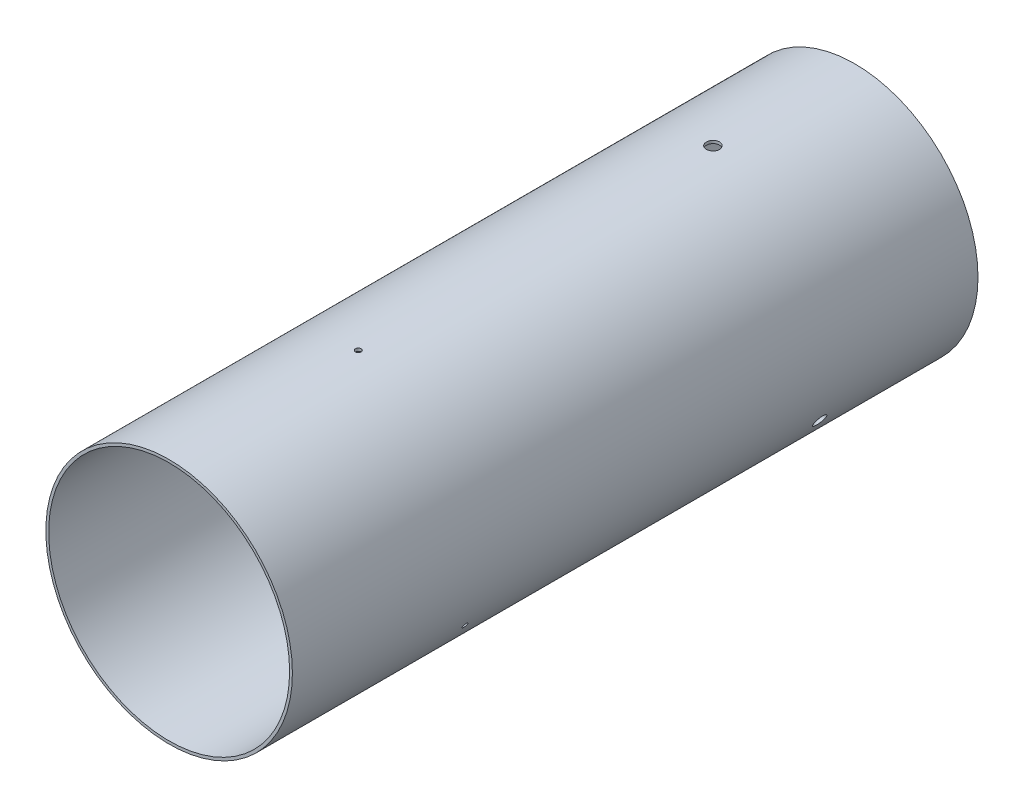
from build123d import *

# Parameters (mm, degrees)
SKETCH1_R                = 49.6697
SKETCH1_R_2              = 48.5394
BOSS_EXTRUDE1_DEPTH      = 276.225
SKETCH2_R                = 2.6289
SKETCH2_R_2              = 1.143
F_8_32_T_NUT_HOLES_DEPTH = 5.08
SKETCH3_R                = 2.6289
SKETCH3_R_2              = 1.143
ODD_T_NUT_DEPTH          = 2.54
CIRPATTERN1_COUNT        = 2
CIRPATTERN1_ANGLE        = 120


with BuildPart() as part:
    # Sketch1 → Boss-Extrude1 (new body)
    with BuildSketch(Plane.XY):
        Circle(SKETCH1_R)
        Circle(SKETCH1_R_2, mode=Mode.SUBTRACT)
    extrude(amount=BOSS_EXTRUDE1_DEPTH)

    # Sketch2 → 8-32 T-Nut Holes (cut)
    with BuildSketch(Plane(origin=(0, 49.6697, 0), x_dir=(1, 0, 0), z_dir=(0, 1, 0))):
        with Locations((0, -57.15)):
            Circle(SKETCH2_R)
        with Locations((0, -200.025)):
            Circle(SKETCH2_R_2)
    f_8_32_t_nut_holes = extrude(amount=-F_8_32_T_NUT_HOLES_DEPTH, mode=Mode.SUBTRACT)

    # Sketch3 → Odd_T-Nut (cut)
    with BuildSketch(Plane(origin=(-43.015221998, -24.83485, 0), x_dir=(0, 0, 1), z_dir=(-0.8660254037844398, -0.49999999999999784, 0))):
        with Locations((60.325, 0)):
            Circle(SKETCH3_R)
        with Locations((196.85, 0)):
            Circle(SKETCH3_R_2)
    extrude(amount=-ODD_T_NUT_DEPTH, mode=Mode.SUBTRACT)

    # CirPattern1: 8-32 T-Nut Holes ×2 about axis
    cirpattern1_axis = Axis((0, 0, 276.225), (0, 0, -1))
    for i in range(1, CIRPATTERN1_COUNT):
        add(f_8_32_t_nut_holes.rotate(cirpattern1_axis, i * CIRPATTERN1_ANGLE / (CIRPATTERN1_COUNT - 1)), mode=Mode.SUBTRACT)


solid = part.part
